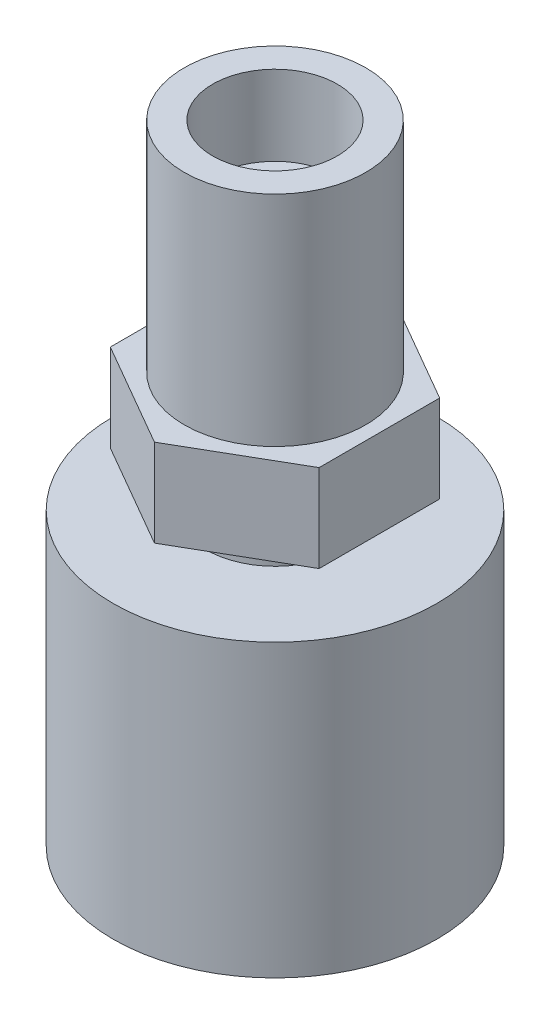
from build123d import *

# Parameters (mm, degrees)
SKETCH1_R            = 8.3
BOSS_EXTRUDE1_DEPTH  = 20
BOSS_EXTRUDE2_DEPTH  = 8
SKETCH3_R            = 4.6
CUT_EXTRUDE1_DEPTH   = 16
SKETCH4_R            = 5.7
CUT_EXTRUDE2_DEPTH   = 7.3
SKETCH5_R            = 3.1
CUT_EXTRUDE3_DEPTH   = 2
SKETCH7_R            = 6.3
BOSS_EXTRUDE3_DEPTH  = 2.9
SKETCH6_R            = 2
CUT_EXTRUDE4_DEPTH   = 10.5
FILLET1_R            = 2.368
SKETCH9_R            = 14.8
BOSS_EXTRUDE5_DEPTH  = 26.6
SKETCH10_R           = 11.1
CUT_EXTRUDE5_DEPTH   = 7.9
SKETCH11_R           = 13.6
CUT_EXTRUDE6_DEPTH   = 1.2
SKETCH12_R           = 8.4
SKETCH12_R_2         = 6.3
BOSS_EXTRUDE6_DEPTH  = 2.4
CUT_SWEEP2_START     = -31.593597178
CUT_SWEEP2_OUTLINE_R = 1
CUT_SWEEP2_DEPTH     = 24.495000761


with BuildPart() as part:
    # Sketch1 → Boss-Extrude1 (new body)
    with BuildSketch(Plane(origin=(0, 0, 0), x_dir=(1, 0, 0), z_dir=(0, 1, 0))):
        with Locations(Location((0, 0, 0), (0, 0, 270))):
            Circle(SKETCH1_R)
    extrude(amount=BOSS_EXTRUDE1_DEPTH)

    # Sketch2 → Boss-Extrude2 (add)
    with BuildSketch(Plane.XZ):
        Polygon((0, 11.027390142), (-9.55, 5.513695071), (-9.55, -5.513695071), (0, -11.027390142), (9.55, -5.513695071), (9.55, 5.513695071), align=None)
    extrude(amount=BOSS_EXTRUDE2_DEPTH)

    # Sketch3 → Cut-Extrude1 (cut)
    with BuildSketch(Plane(origin=(0, 20, 0), x_dir=(1, 0, 0), z_dir=(0, 1, 0))):
        with Locations(Location((0, 0, 0), (0, 0, 270))):
            Circle(SKETCH3_R)
    extrude(amount=-CUT_EXTRUDE1_DEPTH, mode=Mode.SUBTRACT)

    # Sketch4 → Cut-Extrude2 (cut)
    with BuildSketch(Plane(origin=(0, 20, 0), x_dir=(1, 0, 0), z_dir=(0, 1, 0))):
        with Locations(Location((0, 0, 0), (0, 0, 270))):
            Circle(SKETCH4_R)
    extrude(amount=-CUT_EXTRUDE2_DEPTH, mode=Mode.SUBTRACT)

    # Sketch5 → Cut-Extrude3 (cut)
    with BuildSketch(Plane(origin=(0, 4, 0), x_dir=(1, 0, 0), z_dir=(0, 1, 0))):
        with Locations(Location((0, 0, 0), (0, 0, 270))):
            Circle(SKETCH5_R)
    extrude(amount=-CUT_EXTRUDE3_DEPTH, mode=Mode.SUBTRACT)

    # Sketch7 → Boss-Extrude3 (add)
    with BuildSketch(Plane.XZ.offset(8)):
        with Locations(Location((0, 0, 0), (0, 0, 270))):
            Circle(SKETCH7_R)
    extrude(amount=BOSS_EXTRUDE3_DEPTH)

    # Sketch6 → Cut-Extrude4 (cut)
    with BuildSketch(Plane(origin=(0, 2, 0), x_dir=(1, 0, 0), z_dir=(0, 1, 0))):
        with Locations(Location((0, 0, 0), (0, 0, 270))):
            Circle(SKETCH6_R)
    extrude(amount=-CUT_EXTRUDE4_DEPTH, mode=Mode.SUBTRACT)

    # Fillet1
    # the kernel refuses this fillet: 2.368 mm, written as the material it adds along each edge
    with BuildSketch(Plane(origin=(0, 2, 0), x_dir=(0, 0, 1), z_dir=(-1, 0, 0))) as fillet1_piece_1:
        with BuildLine():
            CenterArc((0.732, 1.999899998), FILLET1_R, 302.375992961, 57.624007039)
            Line((2, 0), (3.1, 0))
            Line((3.1, 0), (3.1, 1.999899998))
        make_face()
    revolve(axis=Axis((0, 2, 0), (0, 1, 0)))

    # Sketch9 → Boss-Extrude5 (add)
    with BuildSketch(Plane.XZ.offset(10.9)):
        with Locations(Location((0, 0, 0), (0, 0, 270))):
            Circle(SKETCH9_R)
    extrude(amount=BOSS_EXTRUDE5_DEPTH)

    # Sketch10 → Cut-Extrude5 (cut)
    with BuildSketch(Plane.XZ.offset(37.5)):
        with Locations(Location((0, 0, 0), (0, 0, 270))):
            Circle(SKETCH10_R)
    extrude(amount=-CUT_EXTRUDE5_DEPTH, mode=Mode.SUBTRACT)

    # Sketch11 → Cut-Extrude6 (cut)
    with BuildSketch(Plane.XZ.offset(37.5)):
        with Locations(Location((0, 0, 0), (0, 0, 270))):
            Circle(SKETCH11_R)
    extrude(amount=-CUT_EXTRUDE6_DEPTH, mode=Mode.SUBTRACT)

    # Sketch12 → Boss-Extrude6 (add)
    with BuildSketch(Plane.XZ.offset(29.6)):
        with Locations(Location((0, 0, 0), (0, 0, 270))):
            Circle(SKETCH12_R)
        with Locations(Location((0, 0, 0), (0, 0, 270))):
            Circle(SKETCH12_R_2, mode=Mode.SUBTRACT)
    extrude(amount=BOSS_EXTRUDE6_DEPTH)

    # Cut-Sweep2: read off the stored shape, not the designer's step
    # Cut-Sweep2 outline → Cut-Sweep2 (cut)
    with BuildSketch(Plane(origin=(0, 0, 0), x_dir=(1, 0, 0), z_dir=(0, 0.9247029674801356, -0.38068940349506886)).offset(CUT_SWEEP2_START)):
        with Locations((0, 2.012129639)):
            Circle(CUT_SWEEP2_OUTLINE_R)
    extrude(amount=CUT_SWEEP2_DEPTH, mode=Mode.SUBTRACT)


solid = part.part
